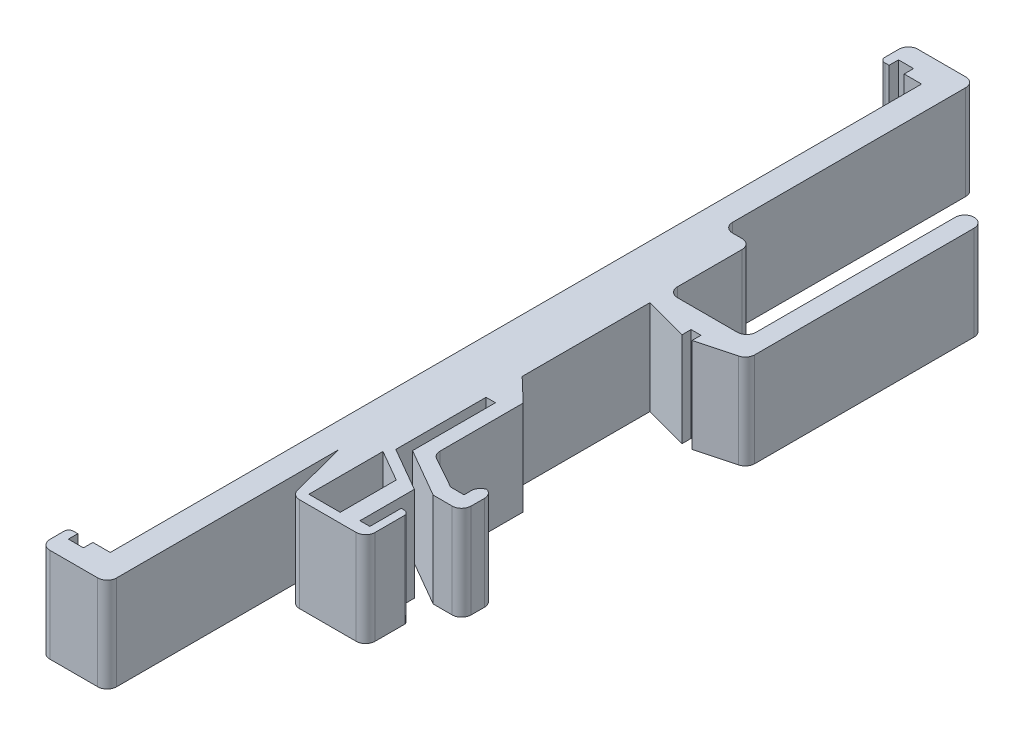
from build123d import *

# Parameters (mm, degrees)
BOSS_EXTRUDE1_DEPTH = 10
FILLET1_R           = 1
FILLET2_R           = 0.5


with BuildPart() as part:
    # Sketch1 → Boss-Extrude1 (new body)
    with BuildSketch(Plane.XZ.offset(10)):
        Polygon((2.804347826, 17.533503473), (5.304347826, 19.924807821), (5.304347826, 29.324187975), (9.169667061, 31.480524519), (10.595176157, 31.480524519), (10.577761024, 29.730396695), (12.012614665, 29.730396695), (11.981340388, 33.141498149), (8.981340388, 33.141498149), (3.804347826, 30.1525601), (3.804347826, 21.359590429), (2.804347826, 21.359590429), (2.804347826, 30.924807821), (7.452279989, 33.608292706), (7.452279989, 39.375896583), (8.502279989, 39.375896583), (8.502279989, 36.050651768), (9.328366946, 36.050651768), (9.328366946, 40.650651768), (1.538219203, 40.650651768), (-0.195652174, 33.954999595), (-0.195652174, 58.52173913), (-7.269565217, 58.52173913), (-7.269565217, 55.52173913), (-6.313043478, 55.52173913), (-6.313043478, 56.52173913), (-4.713043478, 56.52173913), (-4.713043478, 55.52173913), (-2.869565217, 55.52173913), (-2.869565217, 4.387220823), (-2.869565217, -9.434782609), (-2.869565217, -30.47826087), (-4.713043478, -30.47826087), (-4.713043478, -31.47826087), (-6.313043478, -31.47826087), (-6.313043478, -30.47826087), (-7.269565217, -30.47826087), (-7.269565217, -33.47826087), (-0.195652174, -33.47826087), (-0.195652174, -6.777713361), (2.804347826, -6.777713361), (2.804347826, 2.073965174), (11.146243443, 2.073965174), (11.146243443, -21.034930407), (13.146243443, -21.034930407), (13.146243443, 3.987008652), (8.502279989, 5.232418322), (8.502279989, 4.275896583), (7.452279989, 4.275896583), (7.452279989, 5.232418322), (2.804347826, 3.987008652), align=None)
        Polygon((2.31416262, 31.796499798), (2.31416262, 39.650651768), (5.638358328, 39.650651768), (5.638358328, 33.715725085), align=None, mode=Mode.SUBTRACT)
    extrude(amount=-BOSS_EXTRUDE1_DEPTH)

    # Fillet1
    # the kernel refuses this fillet: 1 mm, written as the material it adds along each edge
    with BuildSketch(Plane(origin=(2.804347826, -10, 2.073965174), x_dir=(1, 0, 0), z_dir=(0, 1, 0)), Plane(origin=(-0.195652174, -10, -6.777713361), x_dir=(1, 0, 0), z_dir=(0, 1, 0)), Plane(origin=(11.146243443, -10, 2.073965174), x_dir=(0, 0, -1), z_dir=(0, 1, 0))) as fillet1_piece_1:
        with BuildLine():
            CenterArc((FILLET1_R, FILLET1_R), FILLET1_R, 180, 90)
            Line((0, FILLET1_R), (0, 0))
            Line((0, 0), (FILLET1_R, 0))
        make_face()
    extrude(amount=10)
    with BuildSketch(Plane(origin=(5.304347826, -10, 29.324187975), x_dir=(0.8732987298442874, 0, 0.48718510696895734), z_dir=(0, 1, 0))) as fillet1_piece_2:
        with BuildLine():
            CenterArc((FILLET1_R * 0.587215892462, FILLET1_R), FILLET1_R, 209.155734131, 60.844265869)
            Line((-FILLET1_R * 0.286082837383, FILLET1_R * 0.512814893031), (0, 0))
            Line((0, 0), (FILLET1_R * 0.587215892462, 0))
        make_face()
    extrude(amount=10)
    # the kernel refuses this fillet: 1 mm, written as the material it takes off along each edge
    with BuildSketch(Plane(origin=(11.981340388, -12.47718412, 33.141498149), x_dir=(0.009167995584995172, 0, -0.9999579730453443), z_dir=(0, 1, 0))) as fillet1_2_piece_1:
        with BuildLine():
            CenterArc((FILLET1_R * 0.990873647817, FILLET1_R), FILLET1_R, 180.525294812, 89.474705188)
            Line((-FILLET1_R * 0.00908432522847, FILLET1_R * 0.990832004415), (0, 0))
            Line((0, 0), (FILLET1_R * 0.990873647817, 0))
        make_face()
    extrude(amount=14.954368239, mode=Mode.SUBTRACT)
    with BuildSketch(Plane(origin=(10.577761024, -12.525000715, 29.730396695), x_dir=(0.009950285545768225, 0, 0.9999504946833906), z_dir=(0, 1, 0))) as fillet1_2_piece_2:
        with BuildLine():
            CenterArc((FILLET1_R * 1.01000028593, FILLET1_R), FILLET1_R, 179.429881225, 90.570118775)
            Line((FILLET1_R * 0.0100497912463, FILLET1_R * 1.00995028555), (0, 0))
            Line((0, 0), (FILLET1_R * 1.01000028593, 0))
        make_face()
    extrude(amount=15.05000143, mode=Mode.SUBTRACT)
    with BuildSketch(Plane(origin=(12.012614665, -12.523026024, 29.730396695), x_dir=(-1, 0, 0), z_dir=(0, 1, 0))) as fillet1_2_piece_3:
        with BuildLine():
            CenterArc((FILLET1_R * 1.00921040963, FILLET1_R), FILLET1_R, 179.474705188, 90.525294812)
            Line((FILLET1_R * 0.00925243657978, FILLET1_R * 1.00916799558), (0, 0))
            Line((0, 0), (FILLET1_R * 1.00921040963, 0))
        make_face()
    extrude(amount=15.046052048, mode=Mode.SUBTRACT)
    with BuildSketch(Plane(origin=(13.146243443, -12.5, -21.034930407), x_dir=(-1, 0, 0), z_dir=(0, 1, 0)), Plane(origin=(2.804347826, -12.5, -6.777713361), x_dir=(-1, 0, 0), z_dir=(0, 1, 0)), Plane(origin=(11.146243443, -12.5, -21.034930407), x_dir=(0, 0, 1), z_dir=(0, 1, 0)), Plane(origin=(-0.195652174, -12.5, -33.47826087), x_dir=(-1, 0, 0), z_dir=(0, 1, 0)), Plane(origin=(-7.269565217, -12.5, -33.47826087), x_dir=(0, 0, 1), z_dir=(0, 1, 0)), Plane(origin=(-7.269565217, -12.5, 58.52173913), x_dir=(1, 0, 0), z_dir=(0, 1, 0)), Plane(origin=(-0.195652174, -12.5, 58.52173913), x_dir=(0, 0, -1), z_dir=(0, 1, 0)), Plane(origin=(9.328366946, -12.5, 40.650651768), x_dir=(0, 0, -1), z_dir=(0, 1, 0))) as fillet1_2_piece_4:
        with BuildLine():
            CenterArc((FILLET1_R, FILLET1_R), FILLET1_R, 180, 90)
            Line((0, FILLET1_R), (0, 0))
            Line((0, 0), (FILLET1_R, 0))
        make_face()
    extrude(amount=15, mode=Mode.SUBTRACT)
    with BuildSketch(Plane(origin=(13.146243443, -11.917893225, 3.987008652), x_dir=(0, 0, -1), z_dir=(0, 1, 0))) as fillet1_2_piece_5:
        with BuildLine():
            CenterArc((FILLET1_R * 0.76715728997, FILLET1_R), FILLET1_R, 195.012240475, 74.987759525)
            Line((-FILLET1_R * 0.198713221058, FILLET1_R * 0.740974603702), (0, 0))
            Line((0, 0), (FILLET1_R * 0.76715728997, 0))
        make_face()
    extrude(amount=13.83578645, mode=Mode.SUBTRACT)
    with BuildSketch(Plane(origin=(1.538219203, -11.935074959, 40.650651768), x_dir=(1, 0, 0), z_dir=(0, 1, 0))) as fillet1_2_piece_6:
        with BuildLine():
            CenterArc((FILLET1_R * 0.774029983779, FILLET1_R), FILLET1_R, 194.518109178, 75.481890822)
            Line((-FILLET1_R * 0.19403847194, FILLET1_R * 0.749314011077), (0, 0))
            Line((0, 0), (FILLET1_R * 0.774029983779, 0))
        make_face()
    extrude(amount=13.870149919, mode=Mode.SUBTRACT)

    # Fillet2
    fillet2_edges = [part.edges().sort_by_distance(p)[0] for p in [
        (-7.269565217, -5, -30.47826087),
        (-7.269565217, -5, 55.52173913),
        (9.328366946, -5, 36.050651768),
    ]]
    fillet(fillet2_edges, radius=FILLET2_R)


solid = part.part
